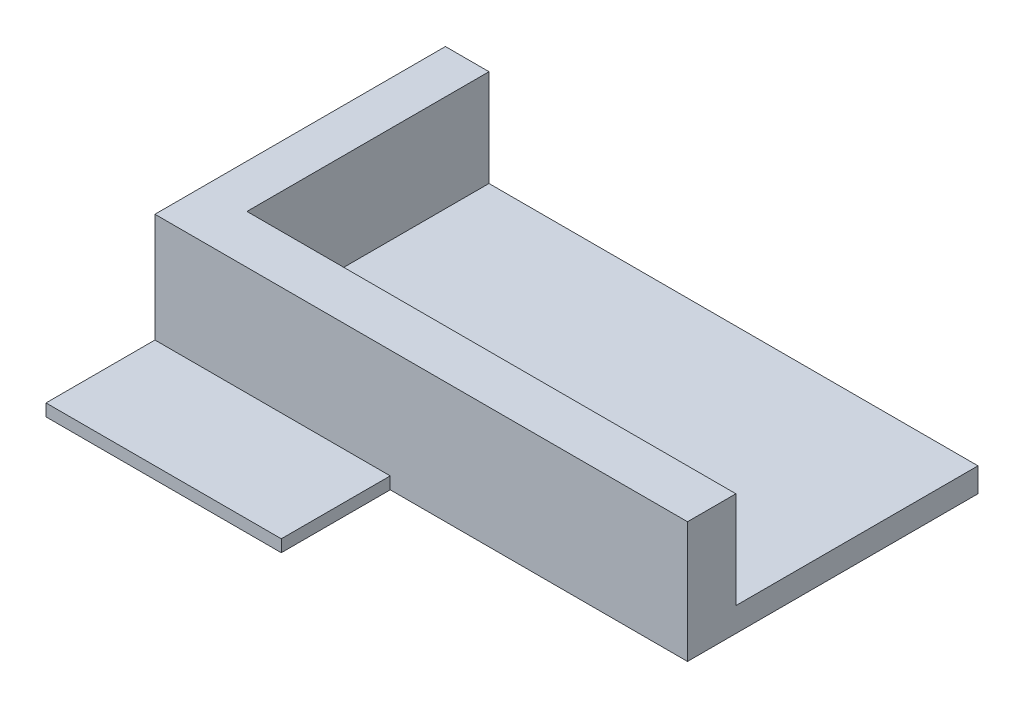
from build123d import *

# Parameters (mm, degrees)
SKETCH1_W           = 139.7
SKETCH1_H           = 76.2
BOSS_EXTRUDE1_DEPTH = 31.75
SKETCH2_W           = 128.27
SKETCH2_H           = 63.545947231
CUT_EXTRUDE1_DEPTH  = 25.4
SKETCH3_W           = 10.16
SKETCH3_H           = 10.16
BOSS_EXTRUDE3_DEPTH = 12.7
SKETCH4_R           = 2.032
CUT_EXTRUDE2_DEPTH  = 82.814026915
SKETCH5_R           = 3.937
CUT_EXTRUDE3_DEPTH  = 2.286
SKETCH6_W           = 61.722
SKETCH6_H           = 3.175
BOSS_EXTRUDE4_DEPTH = 28.575


with BuildPart() as part:
    # Sketch1 → Boss-Extrude1 (new body)
    with BuildSketch(Plane(origin=(0, 0, 0), x_dir=(1, 0, 0), z_dir=(0, 1, 0))):
        Rectangle(SKETCH1_W, SKETCH1_H)
    extrude(amount=BOSS_EXTRUDE1_DEPTH)

    # Sketch2 → Cut-Extrude1 (cut)
    with BuildSketch(Plane(origin=(0, 31.75, 0), x_dir=(1, 0, 0), z_dir=(0, 1, 0))):
        with Locations((5.715, 6.372973615)):
            Rectangle(SKETCH2_W, SKETCH2_H)
    extrude(amount=-CUT_EXTRUDE1_DEPTH, mode=Mode.SUBTRACT)

    # Sketch3 → Boss-Extrude3 (add)
    with BuildSketch(Plane(origin=(0, 6.35, 0), x_dir=(1, 0, 0), z_dir=(0, 1, 0))):
        with Locations((-53.34, -20.32)):
            Rectangle(SKETCH3_W, SKETCH3_H)
    extrude(amount=BOSS_EXTRUDE3_DEPTH)

    # Sketch4 → Cut-Extrude2 (cut, through all)
    with BuildSketch(Plane(origin=(0, 19.05, 0), x_dir=(1, 0, 0), z_dir=(0, 1, 0))):
        with Locations((-53.34, -20.32)):
            Circle(SKETCH4_R)
    extrude(amount=-CUT_EXTRUDE2_DEPTH, mode=Mode.SUBTRACT)

    # Sketch5 → Cut-Extrude3 (cut)
    with BuildSketch(Plane(origin=(0, 19.05, 0), x_dir=(1, 0, 0), z_dir=(0, 1, 0))):
        with Locations((-53.34, -20.32)):
            Circle(SKETCH5_R)
    extrude(amount=-CUT_EXTRUDE3_DEPTH, mode=Mode.SUBTRACT)

    # Sketch6 → Boss-Extrude4 (add)
    with BuildSketch(Plane.XY.offset(38.1)):
        with Locations((-38.989, 1.5875)):
            Rectangle(SKETCH6_W, SKETCH6_H)
    extrude(amount=BOSS_EXTRUDE4_DEPTH)


solid = part.part
